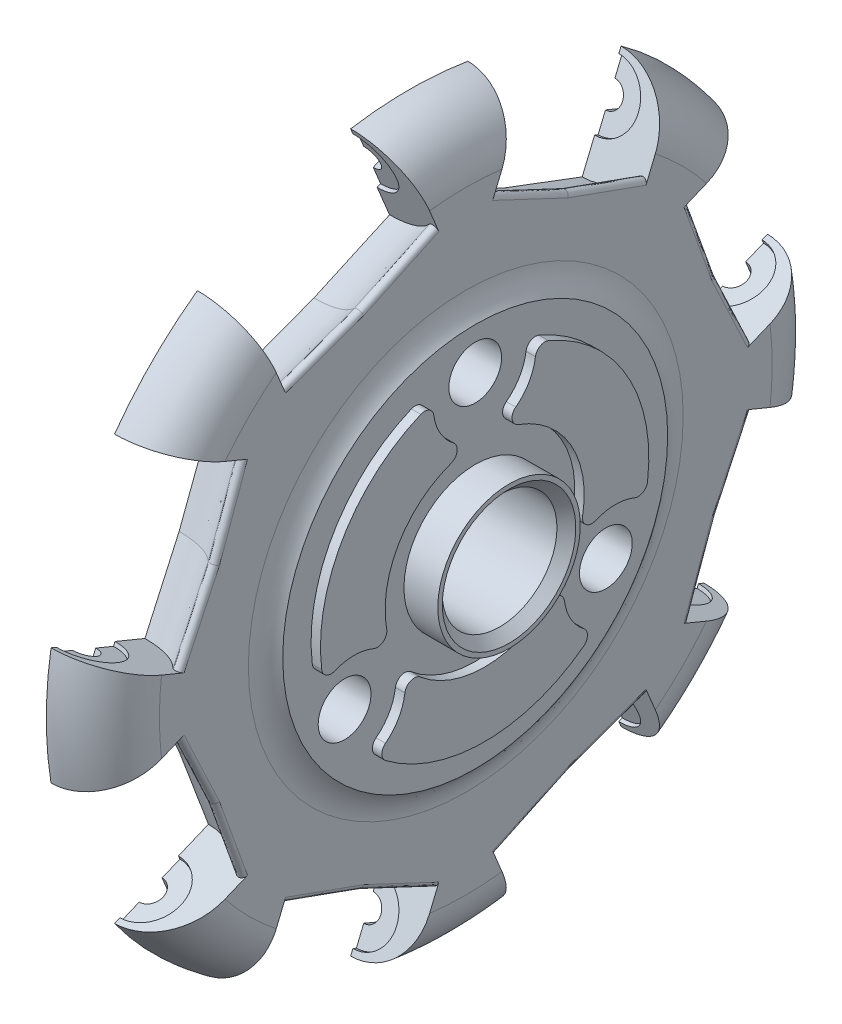
from build123d import *

# Parameters (mm, degrees)
SKETCH2_R                = 30.559375
BOSS_EXTRUDE1_DEPTH      = 4.7625
FILLET2_R                = 4.7625
FILLET4_R                = 0.396875
CIRPATTERN1_COUNT        = 8
FILLET4_OF_CIRPATTERN1_R = 0.396875
SKETCH4_R                = 16.2052
BOSS_EXTRUDE3_DEPTH      = 0.79375
FILLET3_R                = 3.175
SKETCH8_R                = 4.826
CUT_EXTRUDE4_DEPTH       = 44.573188
SKETCH10_R               = 2.2225
CUT_EXTRUDE7_DEPTH       = 44.573188
BOSS_EXTRUDE4_START      = 2.85
SKETCH11_R               = 6
SKETCH11_R_2             = 4.826
BOSS_EXTRUDE4_DEPTH      = 2.85
CHAMFER3_SIZE            = 0.79375
BOSS_EXTRUDE5_DEPTH      = 0.79375
CIRPATTERN3_COUNT        = 3


# Read off the part's stored shape, not the designer's step: Cavity1
# Some blends are built 0.0001 mm under size
with BuildPart() as part:
    # Sketch2 → Boss-Extrude1 (new body)
    with BuildSketch(Plane(origin=(0, 0, 0), x_dir=(0, 0, -1), z_dir=(1, 0, 0))):
        with Locations(Location((0, 0, 0), (0, 0, 180))):
            Circle(SKETCH2_R)
    extrude(amount=BOSS_EXTRUDE1_DEPTH)

    # Fillet2
    fillet2_edges = [part.edges().sort_by_distance(p)[0] for p in [
        (4.7625, 0, -30.559375),
    ]]
    fillet(fillet2_edges, radius=FILLET2_R - 0.0001)  # a hair under: the kernel refuses the full size

    # Cavity1 outline → Cavity1 (revolve, cut)
    with BuildSketch(Plane(origin=(0, 24.566534, 10.175792), x_dir=(1, 0, 0), z_dir=(0, 0.9238795325112864, 0.3826834323650908))):
        Polygon((1.0414, 9.525), (0, 9.525), (0, -9.525), (1.0414, -9.525), (1.0414, -7.3025), (2.667, -7.3025), (2.667, -6.985), (5.3975, -6.985), (5.61975, 0), (5.3975, 6.985), (2.667, 6.985), (2.667, 7.3025), (1.0414, 7.3025), align=None)
    cavity1 = revolve(axis=Axis((0, 24.566534, 10.175792), (0, 0.3826834323650908, -0.9238795325112864)), mode=Mode.SUBTRACT)

    # Fillet4
    fillet4_edges = [part.edges().sort_by_distance(p)[0] for p in [
        (4.7625, 23.345656, 5.889377),
        (4.7625, 20.67229, 12.343453),
    ]]
    fillet(fillet4_edges, radius=FILLET4_R)

    # CirPattern1: Cavity1 ×8 about axis
    cirpattern1_axis = Axis((4.7625, 0, 0), (1, 0, 0))
    for i in range(1, CIRPATTERN1_COUNT):
        add(cavity1.rotate(cirpattern1_axis, i * 360 / CIRPATTERN1_COUNT), mode=Mode.SUBTRACT)

    # Fillet4 of CirPattern1
    fillet4_of_cirpattern1_edges = [part.edges().sort_by_distance(p)[0] for p in [
        (4.7625, 12.343454, 20.67229),
        (4.7625, 5.889377, 23.345656),
        (4.7625, -5.889377, 23.345656),
        (4.7625, -12.343453, 20.67229),
        (4.7625, -20.67229, 12.343454),
        (4.7625, -23.345656, 5.889377),
        (4.7625, -23.345656, -5.889377),
        (4.7625, -20.67229, -12.343453),
        (4.7625, -12.343454, -20.67229),
        (4.7625, -5.889377, -23.345656),
        (4.7625, 5.889377, -23.345656),
        (4.7625, 12.343453, -20.67229),
        (4.7625, 20.67229, -12.343454),
        (4.7625, 23.345656, -5.889377),
    ]]
    fillet(fillet4_of_cirpattern1_edges, radius=FILLET4_OF_CIRPATTERN1_R)

    # Sketch4 → Boss-Extrude3 (add)
    with BuildSketch(Plane(origin=(4.7625, 0, 0), x_dir=(0, 0, -1), z_dir=(1, 0, 0))):
        Circle(SKETCH4_R)
    extrude(amount=BOSS_EXTRUDE3_DEPTH)

    # Fillet3
    # the kernel refuses this fillet: 3.175 mm, written as the material it adds along each edge
    with BuildSketch(Plane(origin=(4.7625, 0, 0), x_dir=(0, 0, -1), z_dir=(0, -1, 0))) as fillet3_piece_1:
        with BuildLine():
            CenterArc((18.305265, 3.175), FILLET3_R, 228.590378, 41.409622)
            Line((16.2052, 0.79375), (16.163199, 0.746125))
            ThreePointArc((16.163199, 0.746125), (16.1417, 0.396875), (16.1417, 0))
            Line((16.1417, 0), (16.2052, -0.0635))
            Line((16.2052, -0.0635), (18.305265, -0.0635))
            Line((18.305265, -0.0635), (18.305265, 0))
        make_face()
    revolve(axis=Axis((4.7625, 0, 0), (1, 0, 0)))

    # Sketch8 → Cut-Extrude4 (cut, through all)
    with BuildSketch(Plane(origin=(5.55625, 0, 0), x_dir=(0, 0, -1), z_dir=(1, 0, 0))):
        Circle(SKETCH8_R)
    extrude(amount=-CUT_EXTRUDE4_DEPTH, mode=Mode.SUBTRACT)

    # Sketch10 → Cut-Extrude7 (cut, through all)
    with BuildSketch(Plane.ZY):
        with Locations((-10.998523, -6.35)):
            Circle(SKETCH10_R)
        with Locations((0, 12.7)):
            Circle(SKETCH10_R)
        with Locations((10.998523, -6.35)):
            Circle(SKETCH10_R)
    extrude(amount=-CUT_EXTRUDE7_DEPTH, mode=Mode.SUBTRACT)

    # Sketch11 → Boss-Extrude4 (add)
    with BuildSketch(Plane(origin=(5.55625, 0, 0), x_dir=(0, 0, -1), z_dir=(1, 0, 0)).offset(BOSS_EXTRUDE4_START)):
        with Locations(Location((0, 0, 0), (0, 0, 180))):
            Circle(SKETCH11_R)
        Circle(SKETCH11_R_2, mode=Mode.SUBTRACT)
    extrude(amount=-BOSS_EXTRUDE4_DEPTH)

    # Chamfer3
    chamfer3_edges = [part.edges().sort_by_distance(p)[0] for p in [
        (8.40625, 0, 4.826),
    ]]
    chamfer(chamfer3_edges, length=CHAMFER3_SIZE)

    # Sketch12 → Boss-Extrude5 (add)
    with BuildSketch(Plane(origin=(5.55625, 0, 0), x_dir=(0, 0, -1), z_dir=(1, 0, 0))):
        with BuildLine():
            ThreePointArc((13.717197, -1.714672), (11.971892, 6.911975), (5.373649, 12.736777))
            ThreePointArc((5.373649, 12.736777), (4.67233, 12.695211), (4.278711, 12.113284))
            ThreePointArc((4.278711, 12.113284), (3.731245, 10.52528), (2.619345, 9.266251))
            ThreePointArc((2.619345, 9.266251), (2.316336, 8.513828), (2.832505, 7.888109))
            ThreePointArc((2.832505, 7.888109), (7.258375, 4.190625), (8.247555, -1.491034))
            ThreePointArc((8.247555, -1.491034), (8.531359, -2.250908), (9.334481, -2.364706))
            ThreePointArc((9.334481, -2.364706), (10.980782, -2.031286), (12.629767, -2.35117))
            ThreePointArc((12.629767, -2.35117), (13.330541, -2.301249), (13.717197, -1.714672))
        make_face()
    boss_extrude5 = extrude(amount=BOSS_EXTRUDE5_DEPTH)

    # CirPattern3: Boss-Extrude5 ×3 about axis
    cirpattern3_axis = Axis((0, 0, 0), (1, 0, 0))
    for i in range(1, CIRPATTERN3_COUNT):
        add(boss_extrude5.rotate(cirpattern3_axis, i * 360 / CIRPATTERN3_COUNT))


solid = part.part
